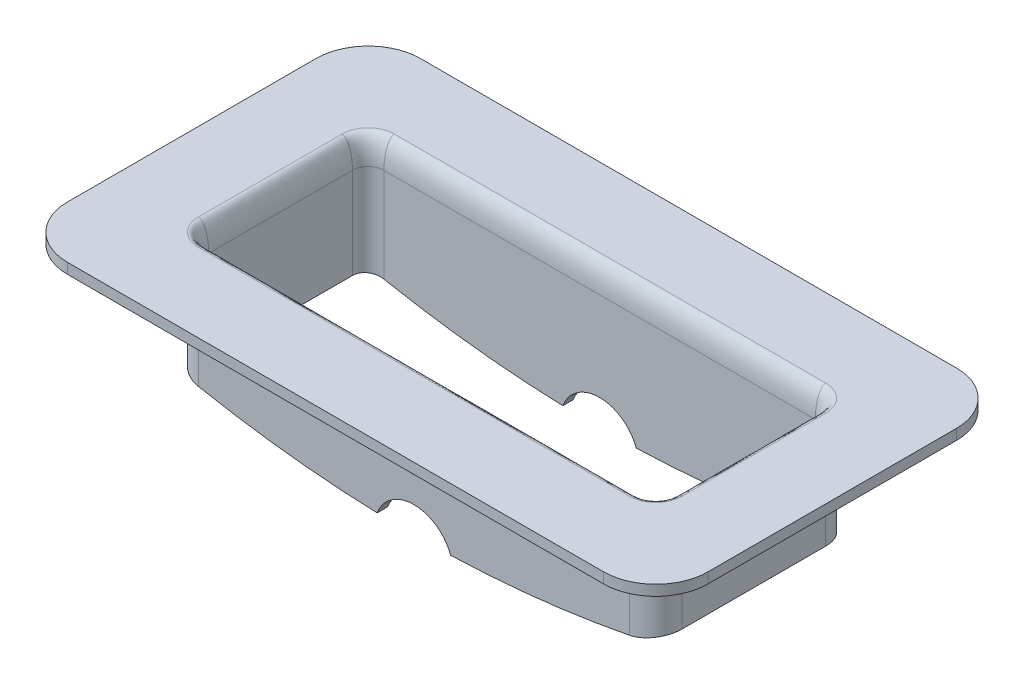
from build123d import *

# Parameters (mm, degrees)
BOSS_EXTRUDE1_DEPTH = 31.75
BOSS_EXTRUDE2_DEPTH = 2.54
FILLET1_R           = 5.715
FILLET3_SIZE        = 6.35
FILLET3_SIZE_2      = 2.54
CUT_EXTRUDE1_DEPTH  = 109.038210315


with BuildPart() as part:
    # Sketch1 → Boss-Extrude1 (new body)
    with BuildSketch(Plane(origin=(0, 0, 0), x_dir=(1, 0, 0), z_dir=(0, 1, 0))):
        with BuildLine():
            Line((-52.3875, 23.8125), (52.3875, 23.8125))
            ThreePointArc((52.3875, 23.8125), (56.877628061, 21.952628061), (58.7375, 17.4625))
            Line((58.7375, 17.4625), (58.7375, -17.4625))
            ThreePointArc((58.7375, -17.4625), (56.877628061, -21.952628061), (52.3875, -23.8125))
            Line((52.3875, -23.8125), (-52.3875, -23.8125))
            ThreePointArc((-52.3875, -23.8125), (-56.877628061, -21.952628061), (-58.7375, -17.4625))
            Line((-58.7375, -17.4625), (-58.7375, 17.4625))
            ThreePointArc((-58.7375, 17.4625), (-56.877628061, 21.952628061), (-52.3875, 23.8125))
        make_face()
        with BuildLine():
            Line((-56.1975, 17.4625), (-56.1975, -17.4625))
            ThreePointArc((-56.1975, -17.4625), (-55.081576836, -20.156576836), (-52.3875, -21.2725))
            Line((-52.3875, -21.2725), (52.3875, -21.2725))
            ThreePointArc((52.3875, -21.2725), (55.081576836, -20.156576836), (56.1975, -17.4625))
            Line((56.1975, -17.4625), (56.1975, 17.4625))
            ThreePointArc((56.1975, 17.4625), (55.081576836, 20.156576836), (52.3875, 21.2725))
            Line((52.3875, 21.2725), (-52.3875, 21.2725))
            ThreePointArc((-52.3875, 21.2725), (-55.081576836, 20.156576836), (-56.1975, 17.4625))
        make_face(mode=Mode.SUBTRACT)
    extrude(amount=BOSS_EXTRUDE1_DEPTH)

    # Sketch2 → Boss-Extrude2 (add)
    with BuildSketch(Plane(origin=(0, 31.75, 0), x_dir=(1, 0, 0), z_dir=(0, 1, 0))):
        with BuildLine():
            Line((-65.0875, -42.8625), (65.0875, -42.8625))
            ThreePointArc((65.0875, -42.8625), (74.067756121, -39.142756121), (77.7875, -30.1625))
            Line((77.7875, -30.1625), (77.7875, 30.1625))
            ThreePointArc((77.7875, 30.1625), (74.067756121, 39.142756121), (65.0875, 42.8625))
            Line((65.0875, 42.8625), (-65.0875, 42.8625))
            ThreePointArc((-65.0875, 42.8625), (-74.067756121, 39.142756121), (-77.7875, 30.1625))
            Line((-77.7875, 30.1625), (-77.7875, -30.1625))
            ThreePointArc((-77.7875, -30.1625), (-74.067756121, -39.142756121), (-65.0875, -42.8625))
        make_face()
        with BuildLine():
            Line((52.3875, 21.2725), (-52.3875, 21.2725))
            ThreePointArc((-52.3875, 21.2725), (-55.081576836, 20.156576836), (-56.1975, 17.4625))
            Line((-56.1975, 17.4625), (-56.1975, -17.4625))
            ThreePointArc((-56.1975, -17.4625), (-55.081576836, -20.156576836), (-52.3875, -21.2725))
            Line((-52.3875, -21.2725), (52.3875, -21.2725))
            ThreePointArc((52.3875, -21.2725), (55.081576836, -20.156576836), (56.1975, -17.4625))
            Line((56.1975, -17.4625), (56.1975, 17.4625))
            ThreePointArc((56.1975, 17.4625), (55.081576836, 20.156576836), (52.3875, 21.2725))
        make_face(mode=Mode.SUBTRACT)
    extrude(amount=BOSS_EXTRUDE2_DEPTH)

    # Fillet1
    fillet1_edges = [part.edges().sort_by_distance(p)[0] for p in [
        (-56.877628061, 31.75, -21.952628061),
        (-58.7375, 31.75, 0),
        (-56.877628061, 31.75, 21.952628061),
        (0, 31.75, 23.8125),
        (56.877628061, 31.75, 21.952628061),
        (58.7375, 31.75, 0),
        (56.877628061, 31.75, -21.952628061),
        (0, 31.75, -23.8125),
    ]]
    fillet(fillet1_edges, radius=FILLET1_R)

    # Fillet3
    # an asymmetric fillet: 6.35, 2.54 mm, written as the material it takes off along each edge
    with BuildSketch(Plane(origin=(-52.3875, 34.29, 21.2725), x_dir=(0, -1, 0), z_dir=(1, 0, 0)), Plane(origin=(52.3875, 34.29, -21.2725), x_dir=(0, -1, 0), z_dir=(-1, 0, 0))) as fillet3_piece_1:
        with BuildLine():
            Bezier((FILLET3_SIZE, 0), (0, 0), (0, -FILLET3_SIZE_2), weights=[1, 0.707106781, 1])
            Line((0, -FILLET3_SIZE_2), (0, 0))
            Line((0, 0), (FILLET3_SIZE, 0))
        make_face()
    extrude(amount=104.775, mode=Mode.SUBTRACT)
    with BuildSketch(Plane(origin=(52.3875, 34.29, 17.4625), x_dir=(0, 0, 1), z_dir=(-1, 0, 0))) as fillet3_piece_2:
        with BuildLine():
            Bezier((3.81, -FILLET3_SIZE), (3.81, 0), (3.81 + FILLET3_SIZE_2, 0), weights=[1, 0.707106781, 1])
            Line((3.81 + FILLET3_SIZE_2, 0), (3.81, 0))
            Line((3.81, 0), (3.81, -FILLET3_SIZE))
        make_face()
    revolve(axis=Axis((52.3875, 34.29, 17.4625), (0, 1, 0)), revolution_arc=90, mode=Mode.SUBTRACT)
    with BuildSketch(Plane(origin=(-52.3875, 34.29, 17.4625), x_dir=(-1, 0, 0), z_dir=(0, 0, -1))) as fillet3_piece_3:
        with BuildLine():
            Bezier((3.81, -FILLET3_SIZE), (3.81, 0), (3.81 + FILLET3_SIZE_2, 0), weights=[1, 0.707106781, 1])
            Line((3.81 + FILLET3_SIZE_2, 0), (3.81, 0))
            Line((3.81, 0), (3.81, -FILLET3_SIZE))
        make_face()
    revolve(axis=Axis((-52.3875, 34.29, 17.4625), (0, 1, 0)), revolution_arc=90, mode=Mode.SUBTRACT)
    with BuildSketch(Plane(origin=(56.1975, 34.29, 17.4625), x_dir=(0, -1, 0), z_dir=(0, 0, -1)), Plane(origin=(-56.1975, 34.29, -17.4625), x_dir=(0, -1, 0), z_dir=(0, 0, 1))) as fillet3_piece_4:
        with BuildLine():
            Bezier((FILLET3_SIZE, 0), (0, 0), (0, -FILLET3_SIZE_2), weights=[1, 0.707106781, 1])
            Line((0, -FILLET3_SIZE_2), (0, 0))
            Line((0, 0), (FILLET3_SIZE, 0))
        make_face()
    extrude(amount=34.925, mode=Mode.SUBTRACT)
    with BuildSketch(Plane(origin=(52.3875, 34.29, -17.4625), x_dir=(1, 0, 0), z_dir=(0, 0, 1))) as fillet3_piece_5:
        with BuildLine():
            Bezier((3.81, -FILLET3_SIZE), (3.81, 0), (3.81 + FILLET3_SIZE_2, 0), weights=[1, 0.707106781, 1])
            Line((3.81 + FILLET3_SIZE_2, 0), (3.81, 0))
            Line((3.81, 0), (3.81, -FILLET3_SIZE))
        make_face()
    revolve(axis=Axis((52.3875, 34.29, -17.4625), (0, 1, 0)), revolution_arc=90, mode=Mode.SUBTRACT)
    with BuildSketch(Plane(origin=(-52.3875, 34.29, -17.4625), x_dir=(0, 0, -1), z_dir=(1, 0, 0))) as fillet3_piece_6:
        with BuildLine():
            Bezier((3.81, -FILLET3_SIZE), (3.81, 0), (3.81 + FILLET3_SIZE_2, 0), weights=[1, 0.707106781, 1])
            Line((3.81 + FILLET3_SIZE_2, 0), (3.81, 0))
            Line((3.81, 0), (3.81, -FILLET3_SIZE))
        make_face()
    revolve(axis=Axis((-52.3875, 34.29, -17.4625), (0, 1, 0)), revolution_arc=90, mode=Mode.SUBTRACT)

    # Sketch3 → Cut-Extrude1 (cut, through all)
    with BuildSketch(Plane.XY.offset(23.8125)):
        with BuildLine():
            Line((-52.3875, 0), (-52.3875, 5.03908358))
            ThreePointArc((-52.3875, 5.03908358), (-55.566366011, 5.675815064), (-58.7375, 6.35))
            Line((-58.7375, 6.35), (-58.7375, 0))
            Line((-58.7375, 0), (-52.3875, 0))
        make_face()
        with BuildLine():
            ThreePointArc((-8.980256121, 0), (-8.954247565, 0.07262614), (-8.927651669, 0.145039258))
            ThreePointArc((-8.927651669, 0.145039258), (-30.755078825, 1.726220229), (-52.3875, 5.03908358))
            Line((-52.3875, 5.03908358), (-52.3875, 0))
            Line((-52.3875, 0), (-8.980256121, 0))
        make_face()
        with BuildLine():
            ThreePointArc((-1.188e-06, 0), (4.464414281, 0.036262197), (8.927651669, 0.145039258))
            ThreePointArc((8.927651669, 0.145039258), (0, 6.35), (-8.927651669, 0.145039258))
            ThreePointArc((-8.927651669, 0.145039258), (-4.464415469, 0.036262216), (-1.188e-06, 0))
        make_face()
        with BuildLine():
            ThreePointArc((8.980256121, 0), (8.954247565, 0.07262614), (8.927651669, 0.145039258))
            ThreePointArc((8.927651669, 0.145039258), (4.464414281, 0.036262197), (-1.188e-06, 0))
            Line((-1.188e-06, 0), (8.980256121, 0))
        make_face()
        with BuildLine():
            ThreePointArc((-1.188e-06, 0), (-4.464415469, 0.036262216), (-8.927651669, 0.145039258))
            ThreePointArc((-8.927651669, 0.145039258), (-8.954247565, 0.07262614), (-8.980256121, 0))
            Line((-8.980256121, 0), (-1.188e-06, 0))
        make_face()
        with BuildLine():
            Line((52.3875, 0), (52.3875, 5.03908358))
            ThreePointArc((52.3875, 5.03908358), (30.755078825, 1.726220229), (8.927651669, 0.145039258))
            ThreePointArc((8.927651669, 0.145039258), (8.954247565, 0.07262614), (8.980256121, 0))
            Line((8.980256121, 0), (52.3875, 0))
        make_face()
        with BuildLine():
            Line((58.7375, 0), (58.7375, 6.35))
            ThreePointArc((58.7375, 6.35), (55.566366011, 5.675815064), (52.3875, 5.03908358))
            Line((52.3875, 5.03908358), (52.3875, 0))
            Line((52.3875, 0), (58.7375, 0))
        make_face()
    extrude(amount=-CUT_EXTRUDE1_DEPTH, mode=Mode.SUBTRACT)


solid = part.part
